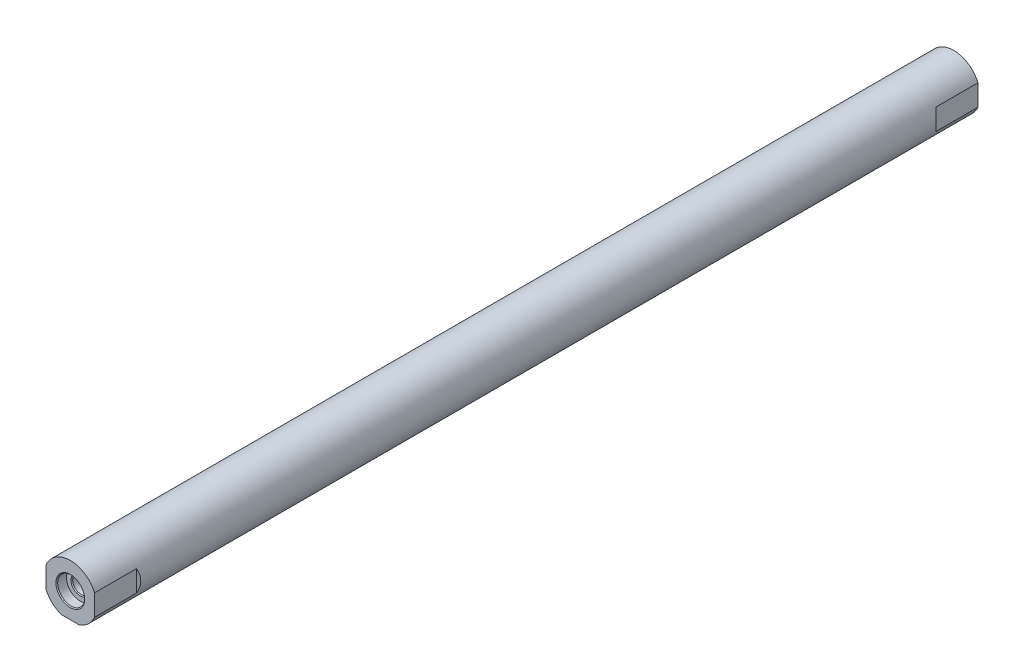
from build123d import *

# Parameters (mm, degrees)
SKETCH1_R                = 6
BOSS_EXTRUDE1_DEPTH      = 100
SKETCH5_R                = 3.05
CUT_EXTRUDE1_DEPTH       = 2.2
CHAMFER1_SIZE            = 0.2
CUT_EXTRUDE2_DEPTH       = 201.179919073
CUT_EXTRUDE4_DEPTH       = 10
CHAMFER3_SIZE            = 0.54
CHAMFER3_OF_MIRROR3_SIZE = 0.54


with BuildPart() as part:
    # Sketch1 → Boss-Extrude1 (new, symmetric)
    with BuildSketch(Plane.XY):
        Circle(SKETCH1_R)
    extrude(amount=BOSS_EXTRUDE1_DEPTH, both=True)

    # Sketch4 → Hole1 (revolve, cut)
    with BuildSketch(Plane(origin=(0, 0, 100), x_dir=(0, -1, 0), z_dir=(1, 0, 0))):
        Polygon((0, 0), (0, 13.85), (1.85, 12), (1.85, 0), align=None)
    hole1 = revolve(axis=Axis((0, 0, 104.244199587), (0, 0, -1)), mode=Mode.SUBTRACT)

    # Sketch5 → Cut-Extrude1 (cut)
    with BuildSketch(Plane.XY.offset(100)):
        Circle(SKETCH5_R)
    cut_extrude1 = extrude(amount=-CUT_EXTRUDE1_DEPTH, mode=Mode.SUBTRACT)

    # Mirror2: Hole1, Cut-Extrude1 across plane
    add(hole1.mirror(Plane.XY), mode=Mode.SUBTRACT)
    add(cut_extrude1.mirror(Plane.XY), mode=Mode.SUBTRACT)

    # Chamfer1
    chamfer1_edges = [part.edges().sort_by_distance(p)[0] for p in [
        (-3.05, 0, 100),
        (0, 1.85, 97.8),
        (-3.05, 0, -100),
        (0, 1.85, -97.8),
    ]]
    chamfer(chamfer1_edges, length=CHAMFER1_SIZE)

    # Sketch6 → Cut-Extrude2 (cut, through all)
    with BuildSketch(Plane.XY.offset(100)):
        with BuildLine():
            Line((2.047046653, -5.64), (-2.047046653, -5.64))
            ThreePointArc((-2.047046653, -5.64), (0, -6), (2.047046653, -5.64))
        make_face()
    extrude(amount=-CUT_EXTRUDE2_DEPTH, mode=Mode.SUBTRACT)

    # Sketch9 → Cut-Extrude4 (cut)
    with BuildSketch(Plane.XY.offset(100)):
        with BuildLine():
            Line((-5.5, -2.397915762), (-5.5, 2.397915762))
            ThreePointArc((-5.5, 2.397915762), (-6, 0), (-5.5, -2.397915762))
        make_face()
        with BuildLine():
            Line((5.5, -2.397915762), (5.5, 2.397915762))
            ThreePointArc((5.5, 2.397915762), (6, 0), (5.5, -2.397915762))
        make_face()
    cut_extrude4 = extrude(amount=-CUT_EXTRUDE4_DEPTH, mode=Mode.SUBTRACT)

    # Chamfer3
    # the kernel refuses this chamfer: 0.54 mm, written as the material it adds along each edge
    with BuildSketch(Plane(origin=(5.5, -3.786624575, 90), x_dir=(-0.027495876610584932, 0, 0.9996219169112968), z_dir=(0, 1, 0))) as chamfer3_piece_1_section:
        Polygon((CHAMFER3_SIZE * 0.999621916911, CHAMFER3_SIZE * 0.0274958766106), (-CHAMFER3_SIZE * 0.0274958766106, CHAMFER3_SIZE * 0.999621916911), (0, 0), align=None)
    chamfer3_piece_1 = extrude(amount=7.57324915, mode=Mode.PRIVATE)
    chamfer3_piece_1 = chamfer3_piece_1 & Plane(origin=(0, 0, 90.196712304), x_dir=(1, 0, 0), z_dir=(0, 0, 1)) * Cylinder(6, 18, mode=Mode.PRIVATE)
    add(chamfer3_piece_1)
    with BuildSketch(Plane(origin=(-5.5, -3.786624575, 90), x_dir=(0.027495876610584932, 0, 0.9996219169112968), z_dir=(0, 1, 0))) as chamfer3_piece_2_section:
        Polygon((CHAMFER3_SIZE * 0.999621916911, -CHAMFER3_SIZE * 0.0274958766106), (-CHAMFER3_SIZE * 0.0274958766106, -CHAMFER3_SIZE * 0.999621916911), (0, 0), align=None)
    chamfer3_piece_2 = extrude(amount=7.57324915, mode=Mode.PRIVATE)
    chamfer3_piece_2 = chamfer3_piece_2 & Plane(origin=(0, 0, 90.196712302), x_dir=(1, 0, 0), z_dir=(0, 0, 1)) * Cylinder(6, 18, mode=Mode.PRIVATE)
    add(chamfer3_piece_2)

    # Mirror3: Cut-Extrude4 across plane
    add(cut_extrude4.mirror(Plane.XY), mode=Mode.SUBTRACT)

    # Chamfer3 of Mirror3
    # the kernel refuses this chamfer: 0.54 mm, written as the material it adds along each edge
    with BuildSketch(Plane(origin=(5.5, -3.786624575, -90), x_dir=(-0.027495876610584932, 0, -0.9996219169112968), z_dir=(0, 1, 0))) as chamfer3_of_mirror3_piece_1_section:
        Polygon((CHAMFER3_OF_MIRROR3_SIZE * 0.999621916911, -CHAMFER3_OF_MIRROR3_SIZE * 0.0274958766106), (-CHAMFER3_OF_MIRROR3_SIZE * 0.0274958766106, -CHAMFER3_OF_MIRROR3_SIZE * 0.999621916911), (0, 0), align=None)
    chamfer3_of_mirror3_piece_1 = extrude(amount=7.57324915, mode=Mode.PRIVATE)
    chamfer3_of_mirror3_piece_1 = chamfer3_of_mirror3_piece_1 & Plane(origin=(0, 0, -90.196712304), x_dir=(1, 0, 0), z_dir=(0, 0, 1)) * Cylinder(6, 18, mode=Mode.PRIVATE)
    add(chamfer3_of_mirror3_piece_1)
    with BuildSketch(Plane(origin=(-5.5, -3.786624575, -90), x_dir=(0.027495876610584932, 0, -0.9996219169112968), z_dir=(0, 1, 0))) as chamfer3_of_mirror3_piece_2_section:
        Polygon((CHAMFER3_OF_MIRROR3_SIZE * 0.999621916911, CHAMFER3_OF_MIRROR3_SIZE * 0.0274958766106), (-CHAMFER3_OF_MIRROR3_SIZE * 0.0274958766106, CHAMFER3_OF_MIRROR3_SIZE * 0.999621916911), (0, 0), align=None)
    chamfer3_of_mirror3_piece_2 = extrude(amount=7.57324915, mode=Mode.PRIVATE)
    chamfer3_of_mirror3_piece_2 = chamfer3_of_mirror3_piece_2 & Plane(origin=(0, 0, -90.196712302), x_dir=(1, 0, 0), z_dir=(0, 0, 1)) * Cylinder(6, 18, mode=Mode.PRIVATE)
    add(chamfer3_of_mirror3_piece_2)


solid = part.part
